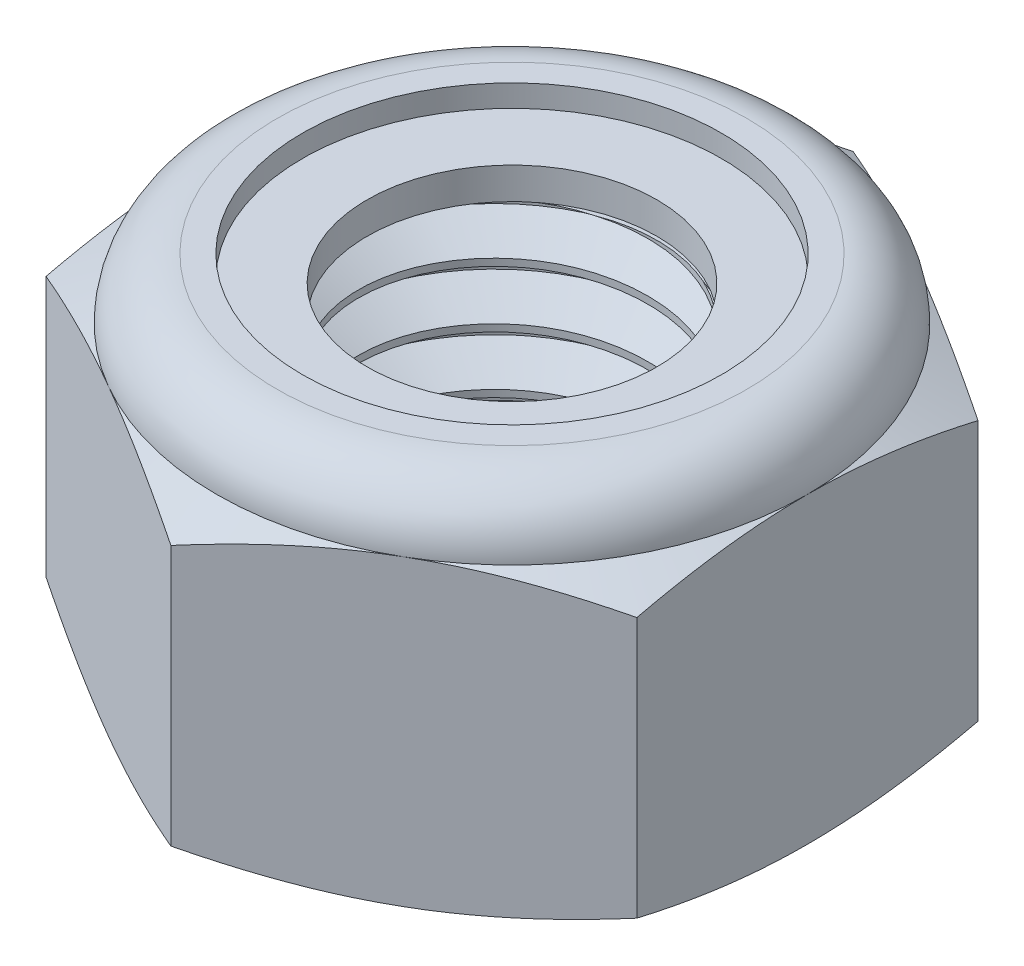
from build123d import *

# Parameters (mm, degrees)
SKETCH1_R      = 4
EXTRUDE1_DEPTH = 8
SWEEP1_PITCH   = 1.25
SPLIT1_START   = 8
SPLIT1_DEPTH   = 2
SPLIT2_START   = -2
SPLIT2_DEPTH   = 2


with BuildPart() as part:
    # Sketch1 → Extrude1 (new body)
    with BuildSketch(Plane(origin=(0, 0, 0), x_dir=(1, 0, 0), z_dir=(0, 1, 0))):
        Polygon((0, 7.505553499), (-6.5, 3.75277675), (-6.5, -3.75277675), (0, -7.505553499), (6.5, -3.75277675), (6.5, 3.75277675), align=None)
        with Locations(Location((0, 0, 0), (0, 0, 270))):
            Circle(SKETCH1_R, mode=Mode.SUBTRACT)
    extrude(amount=EXTRUDE1_DEPTH)

    # Sweep1: arcs per turn and ends read off the stored shape
    # Sweep1: the profile of Sketch9 screwed along a right-hand helix through 7.4 turns, 8 arcs to a turn; built about Z, then put on its axis
    sweep1_z = Axis((0, 0, 0), (0, 0, 1))
    sweep1_corners = [(4.067658235, 0, 0.0390625), (4.067658235, 0, -1.1328125), (3.188101184, 0, -0.625), (3.188101184, 0, -0.46875)]
    with BuildLine(mode=Mode.PRIVATE) as sweep1_profile:
        Line(sweep1_corners[0], sweep1_corners[1])
        Line(sweep1_corners[1], sweep1_corners[2])
        Line(sweep1_corners[2], sweep1_corners[3])
        Line(sweep1_corners[3], sweep1_corners[0])
    sweep1_cap = Face(sweep1_profile.wire())
    sweep1_turn_angles = [0, 22.5, 45, 67.5, 90, 112.5, 135, 157.5, 180, 202.5, 225, 247.5, 270, 292.5, 315, 337.5, 360]
    sweep1_turn_weights = [1, 0.9238795325112867, 1, 0.9238795325112867, 1, 0.9238795325112867, 1, 0.9238795325112867, 1, 0.9238795325112867, 1, 0.9238795325112867, 1, 0.9238795325112867, 1, 0.9238795325112867, 1]
    sweep1_turn_rails = [Edge.make_bspline([Vector(p[0], p[1], 0).rotate(sweep1_z, sweep1_turn_angles[k]) / sweep1_turn_weights[k] + Vector(0, 0, p[2] + SWEEP1_PITCH * sweep1_turn_angles[k] / 360) for k in range(17)], [0, 0, 0, 1, 1, 2, 2, 3, 3, 4, 4, 5, 5, 6, 6, 7, 7, 8, 8, 8], 2, sweep1_turn_weights) for p in sweep1_corners]
    sweep1_turn_sides = [Face.make_surface_from_curves(sweep1_turn_rails[p[0]], sweep1_turn_rails[p[1]]) for p in [(0, 1), (1, 2), (2, 3), (3, 0)]]
    sweep1_last_angles = [2520, 2542.5, 2565, 2587.5, 2610, 2632.5, 2655, 2659.5, 2664]
    sweep1_last_weights = [1, 0.9238795325112867, 1, 0.9238795325112867, 1, 0.9238795325112867, 1, 0.9969173337331261, 1]
    sweep1_last_rails = [Edge.make_bspline([Vector(p[0], p[1], 0).rotate(sweep1_z, sweep1_last_angles[k]) / sweep1_last_weights[k] + Vector(0, 0, p[2] + SWEEP1_PITCH * sweep1_last_angles[k] / 360) for k in range(9)], [0, 0, 0, 1, 1, 2, 2, 3, 3, 4, 4, 4], 2, sweep1_last_weights) for p in sweep1_corners]
    sweep1_last_sides = [Face.make_surface_from_curves(sweep1_last_rails[p[0]], sweep1_last_rails[p[1]]) for p in [(0, 1), (1, 2), (2, 3), (3, 0)]]
    sweep1 = Plane(origin=(0, 8, 0), x_dir=(0, 0, 1), z_dir=(0, -1, 0)) * Solid(Shell([*[p.moved(Location((0, 0, SWEEP1_PITCH * i))) for i in range(7) for p in sweep1_turn_sides], *sweep1_last_sides, sweep1_cap, sweep1_cap.rotate(sweep1_z, 2664).moved(Location((0, 0, SWEEP1_PITCH * 2664 / 360)))]))
    add(sweep1)

    # Split1: read off the stored shape, not the designer's step
    # Split1 outline → Split1 (cut)
    # profile 1 of 2: a face of its own
    with BuildSketch(Plane(origin=(0, 0, 0), x_dir=(1, 0, 0), z_dir=(0, 1, 0)).offset(SPLIT1_START)):
        Polygon((6, 6), (0, 6), (-6, 6), (-6, -6), (6, -6), align=None)
        with BuildLine():
            Line((0, -3.188101184), (0, -4.067658235))
            add(Edge.make_bspline(
                [(0, -4.067658235), (-1.684879208, -4.067658235), (-2.876268721, -2.876268721), (-4.067658235, -1.684879208), (-4.067658235, 0), (-4.067658235, 1.684879208), (-2.876268721, 2.876268721), (-1.684879208, 4.067658235), (0, 4.067658235)],
                knots=[0, 0, 0, 0.015625, 0.015625, 0.03125, 0.03125, 0.046875, 0.046875, 0.0625, 0.0625, 0.0625], degree=2, weights=[1, 0.923879533, 1, 0.923879533, 1, 0.923879533, 1, 0.923879533, 1]))
            Line((0, 4.067658235), (0, -3.188101184))
        make_face(mode=Mode.SUBTRACT)
    # profile 2 of 2: a face of its own
    with BuildSketch(Plane(origin=(0, 0, 0), x_dir=(1, 0, 0), z_dir=(0, 1, 0)).offset(SPLIT1_START)):
        with BuildLine():
            add(Edge.make_bspline(
                [(0, -4.067658235), (-1.684879208, -4.067658235), (-2.876268721, -2.876268721), (-4.067658235, -1.684879208), (-4.067658235, 0), (-4.067658235, 1.684879208), (-2.876268721, 2.876268721), (-1.684879208, 4.067658235), (0, 4.067658235)],
                knots=[0, 0, 0, 0.015625, 0.015625, 0.03125, 0.03125, 0.046875, 0.046875, 0.0625, 0.0625, 0.0625], degree=2, weights=[1, 0.923879533, 1, 0.923879533, 1, 0.923879533, 1, 0.923879533, 1]))
            Line((0, -4.067658235), (0, -3.188101184))
            Line((0, -3.188101184), (0, 4.067658235))
        make_face()
    extrude(amount=SPLIT1_DEPTH, mode=Mode.SUBTRACT)

    # Cut-Extrude1 cone 1 section (through the dimple's axis) → Cut-Extrude1 (revolve, cut)
    with BuildSketch(Plane(origin=(0, 8, 0), x_dir=(0, 0, 1), z_dir=(1, 0, 0))):
        Polygon((0, 0), (4, 0), (0, 4), align=None)
    revolve(axis=Axis((0, 8, 0), (0, -1, 0)), mode=Mode.SUBTRACT)

    # Split2: read off the stored shape, not the designer's step
    # Split2 outline → Split2 (cut)
    with BuildSketch(Plane(origin=(0, 0, 0), x_dir=(1, 0, 0), z_dir=(0, 1, 0)).offset(SPLIT2_START)):
        Polygon((6.5, 3.75277675), (0, 7.505553499), (-6.5, 3.75277675), (-6.5, -3.75277675), (0, -7.505553499), (6.5, -3.75277675), align=None)
    extrude(amount=SPLIT2_DEPTH, mode=Mode.SUBTRACT)

    # Sketch5 → Cut-Revolve3 (revolve, cut)
    with BuildSketch(Plane(origin=(0, 0, 0), x_dir=(0, 0, -1), z_dir=(1, 0, 0))):
        with BuildLine():
            Line((0, 0), (6.5, 0))
            Line((6.5, 0), (7.505553499, 0.468897297))
            Line((7.505553499, 0.468897297), (7.505553499, 6.197769369))
            Line((7.505553499, 6.197769369), (6.5, 6.666666667))
            ThreePointArc((6.5, 6.666666667), (6.109475708, 7.609475708), (5.166666667, 8))
            Line((5.166666667, 8), (5.166666667, 9.27))
            Line((5.166666667, 9.27), (8.775553499, 9.27))
            Line((8.775553499, 9.27), (8.775553499, -1.27))
            Line((8.775553499, -1.27), (0, -1.27))
            Line((0, -1.27), (0, 0))
        make_face()
    revolve(axis=Axis((0, 0, 0), (0, 1, 0)), mode=Mode.SUBTRACT)

    # Sketch6 → Cut-Revolve5 (revolve, cut)
    with BuildSketch(Plane(origin=(0, 0, 0), x_dir=(0, 0, -1), z_dir=(1, 0, 0)), mode=Mode.PRIVATE) as cut_revolve5_sk:
        with BuildLine():
            Line((0, 6.666666667), (6.015151515, 6.666666667))
            ThreePointArc((6.015151515, 6.666666667), (5.766636057, 7.266636057), (5.166666667, 7.515151515))
            Line((5.166666667, 7.515151515), (4.608294931, 7.515151515))
            Line((4.608294931, 7.515151515), (4.608294931, 9.27))
            Line((4.608294931, 9.27), (0, 9.27))
            Line((0, 9.27), (0, 6.666666667))
        make_face()
    revolve(cut_revolve5_sk.sketch.rotate(Axis((0, 9.27, 0), (0, -1, 0)), 180), axis=Axis((0, 9.27, 0), (0, -1, 0)), mode=Mode.SUBTRACT)

    # Sketch4 → Cut-Revolve4 (revolve, cut)
    with BuildSketch(Plane(origin=(0, 0, 0), x_dir=(0, 0, -1), z_dir=(1, 0, 0))):
        Polygon((0, 8), (4, 8), (1, 6.601077026), (1, 1.398922974), (4, 0), (0, 0), align=None)
    revolve(axis=Axis((0, 8, 0), (0, 1, 0)), mode=Mode.SUBTRACT)


with BuildPart() as body_2:
    # Sketch7 → Revolve2 (revolve)
    with BuildSketch(Plane(origin=(0, 0, 0), x_dir=(0, 0, -1), z_dir=(1, 0, 0))):
        with BuildLine():
            Line((3.188101184, 6.742866667), (5.93518306, 6.742866667))
            ThreePointArc((5.93518306, 6.742866667), (5.685114244, 7.239061632), (5.166666667, 7.438951515))
            Line((5.166666667, 7.438951515), (3.188101184, 7.438951515))
            Line((3.188101184, 7.438951515), (3.188101184, 6.742866667))
        make_face()
    revolve(axis=Axis((0, 6.742866667, 0), (0, 1, 0)))


solid = Compound([part.part, body_2.part])
